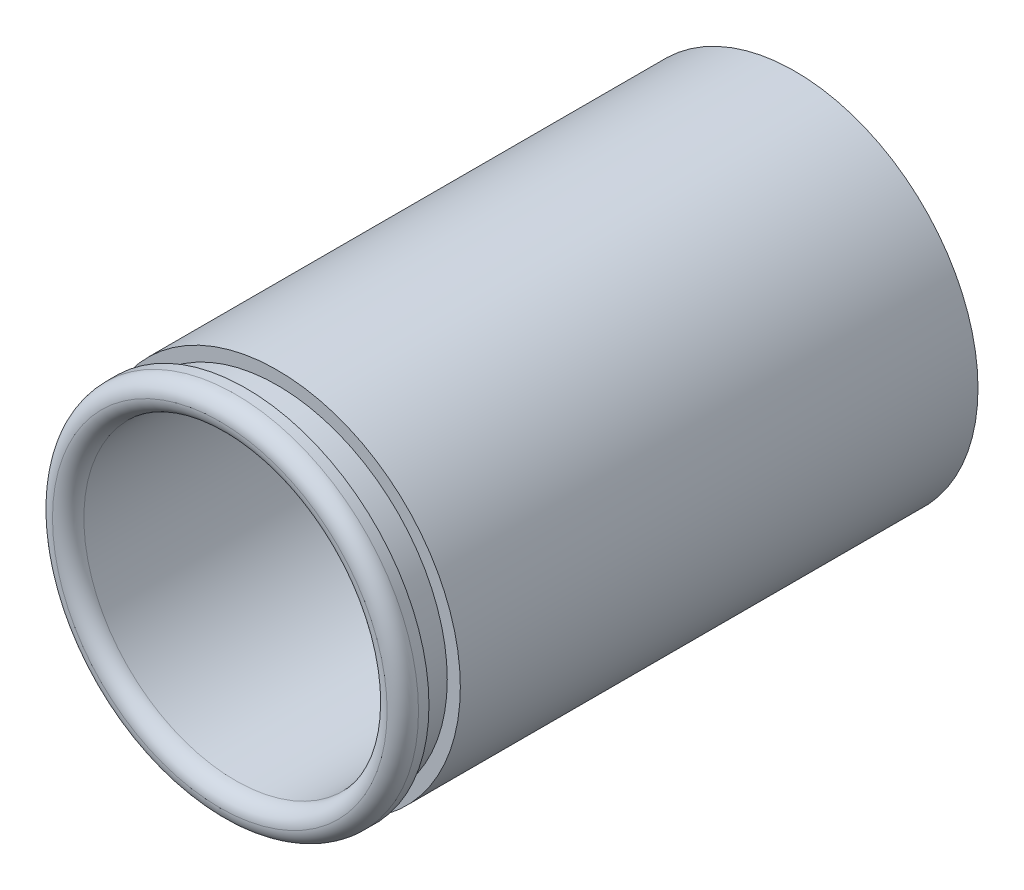
from build123d import *

# Parameters (mm, degrees)
ESQUISSE1_R          = 3.5
ESQUISSE1_R_2        = 2.9
BASE_EXTRUSION_DEPTH = 11
ESQUISSE2_W          = 0.6
ESQUISSE2_H          = 0.25
CONG_3_R             = 0.3


with BuildPart() as part:
    # Esquisse1 → Base-Extrusion (new body)
    with BuildSketch(Plane.XY):
        Circle(ESQUISSE1_R)
        Circle(ESQUISSE1_R_2, mode=Mode.SUBTRACT)
    extrude(amount=BASE_EXTRUSION_DEPTH)

    # Esquisse2 → Enlèvement de matière-Révolution1 (revolve, cut)
    with BuildSketch(Plane(origin=(0, 0, 0), x_dir=(0, 0, -1), z_dir=(1, 0, 0)), mode=Mode.PRIVATE) as enl_vement_de_mati_re_r_volution1_sk:
        with Locations((-10.2, 3.375)):
            Rectangle(ESQUISSE2_W, ESQUISSE2_H)
    revolve(enl_vement_de_mati_re_r_volution1_sk.sketch.rotate(Axis((0, 0, 10), (0, 0, -1)), 90), axis=Axis((0, 0, 10), (0, 0, -1)), mode=Mode.SUBTRACT)

    # Congé3
    cong_3_edges = [part.edges().sort_by_distance(p)[0] for p in [
        (-2.9, 0, 11),
        (-3.5, 0, 11),
    ]]
    fillet(cong_3_edges, radius=CONG_3_R - 0.0001)  # a hair under: the kernel refuses the full size


solid = part.part
